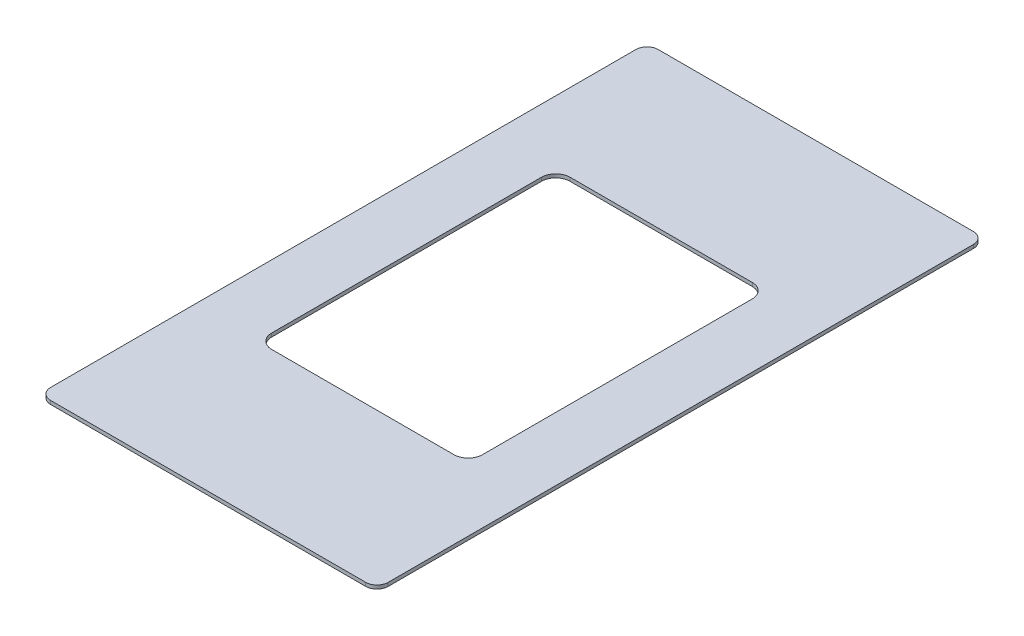
from build123d import *

# Parameters (mm, degrees)
SKETCH9_W           = 300
SKETCH9_H           = 540
SKETCH9_W_2         = 187.325
SKETCH9_H_2         = 265.1125
BOSS_EXTRUDE7_DEPTH = 3.175
FILLET4_R           = 10
FILLET5_R           = 12.7


with BuildPart() as part:
    # Sketch9 → Boss-Extrude7 (new body)
    with BuildSketch(Plane(origin=(0, 0, 0), x_dir=(1, 0, 0), z_dir=(0, 1, 0))):
        with Locations((0, 250)):
            Rectangle(SKETCH9_W, SKETCH9_H)
        with Locations((0, 250)):
            Rectangle(SKETCH9_W_2, SKETCH9_H_2, mode=Mode.SUBTRACT)
    extrude(amount=BOSS_EXTRUDE7_DEPTH)

    # Fillet4
    fillet4_edges = [part.edges().sort_by_distance(p)[0] for p in [
        (-150, 1.5875, -520),
        (150, 1.5875, -520),
        (-150, 1.5875, 20),
        (150, 1.5875, 20),
    ]]
    fillet(fillet4_edges, radius=FILLET4_R)

    # Fillet5
    fillet5_edges = [part.edges().sort_by_distance(p)[0] for p in [
        (-93.6625, 1.5875, -117.44375),
        (93.6625, 1.5875, -117.44375),
        (93.6625, 1.5875, -382.55625),
        (-93.6625, 1.5875, -382.55625),
    ]]
    fillet(fillet5_edges, radius=FILLET5_R)


solid = part.part
